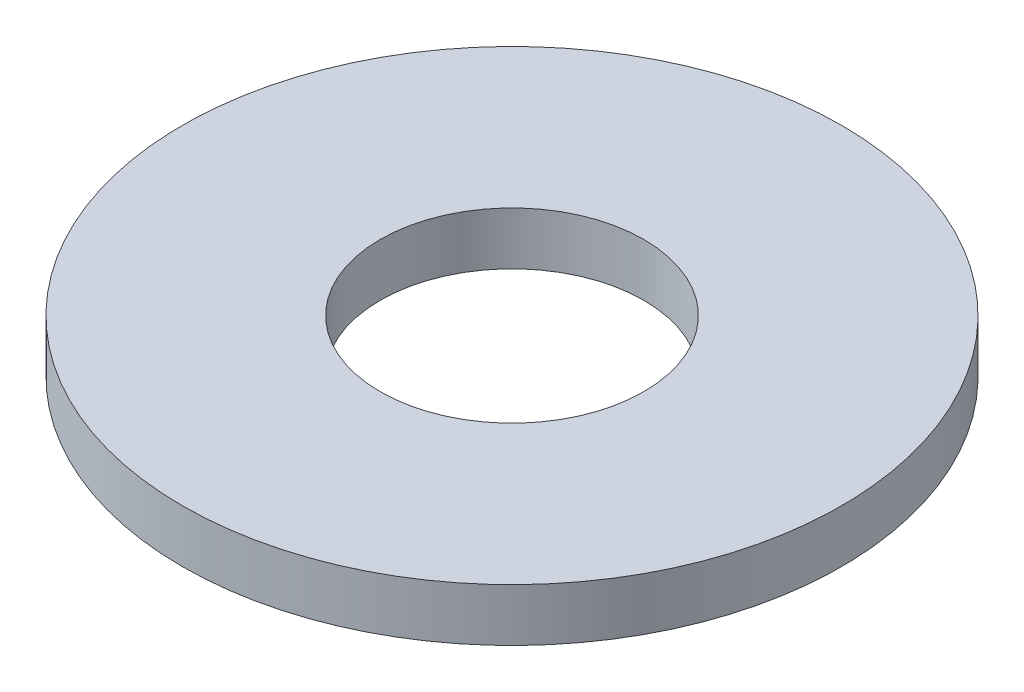
from build123d import *

# Parameters (mm, degrees)
SKETCH1_R           = 37.5
BOSS_EXTRUDE1_DEPTH = 6
SKETCH2_R           = 15
CUT_EXTRUDE1_DEPTH  = 54.371340624


with BuildPart() as part:
    # Sketch1 → Boss-Extrude1 (new body)
    with BuildSketch(Plane(origin=(0, 0, 0), x_dir=(1, 0, 0), z_dir=(0, 1, 0))):
        Circle(SKETCH1_R)
    extrude(amount=BOSS_EXTRUDE1_DEPTH)

    # Sketch2 → Cut-Extrude1 (cut, through all)
    with BuildSketch(Plane(origin=(0, 0, 0), x_dir=(1, 0, 0), z_dir=(0, 1, 0))):
        Circle(SKETCH2_R)
    extrude(amount=CUT_EXTRUDE1_DEPTH, mode=Mode.SUBTRACT)


solid = part.part
